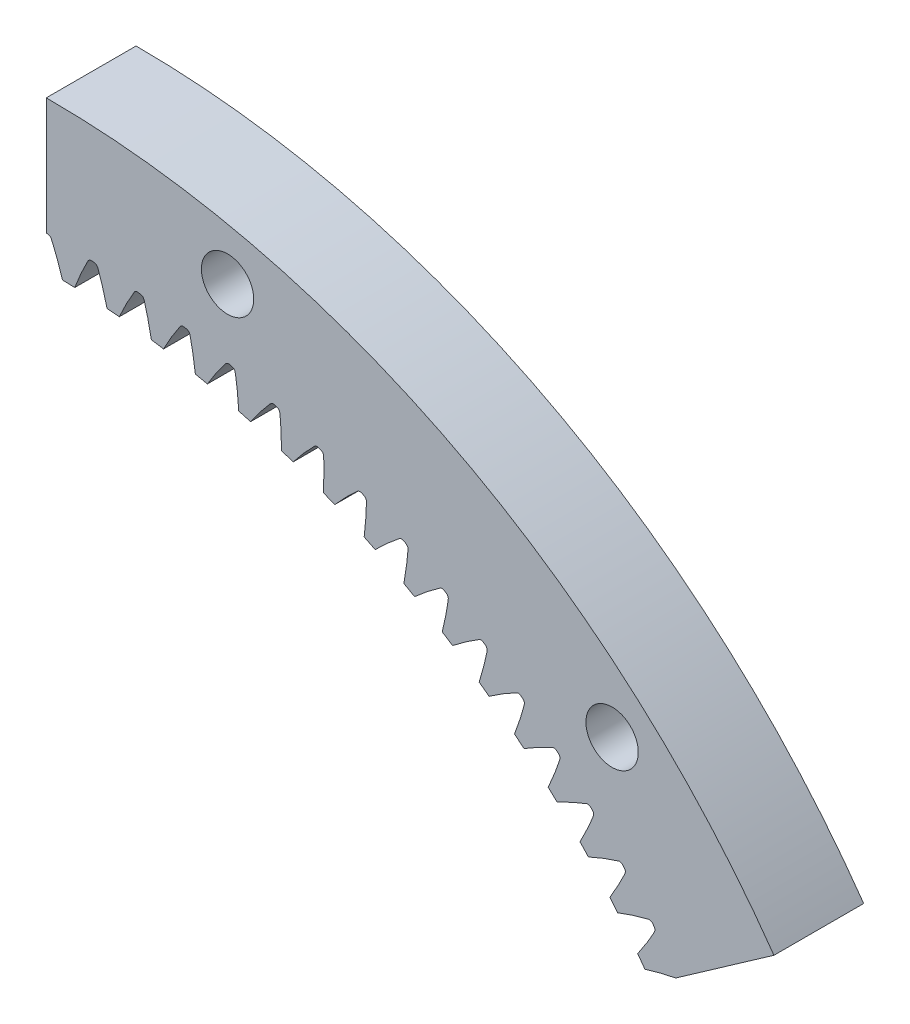
from build123d import *

# Parameters (mm, degrees)
SKETCHREVOLVESPURASSEMBLYNEW2GEAR_W       = 6
SKETCHREVOLVESPURASSEMBLYNEW2GEAR_H       = 10
TOOTHEXTRUDECUTSPURASSEMBLYNEW2GEAR_DEPTH = 4
PATTERNSPURASSEMBLYNEW2GEAR_COUNT         = 104
SKETCH_1_R                                = 1.75
CUT_EXTRUDE_1_DEPTH                       = 85.216931583


with BuildPart() as part:
    # SketchRevolveSpurAssemblyNew2Gear → SpurAssemblyNew2Gear (revolve)
    with BuildSketch(Plane(origin=(0, 0, 0), x_dir=(0, 0, -1), z_dir=(1, 0, 0))):
        with Locations((1, 54.399038462)):
            Rectangle(SKETCHREVOLVESPURASSEMBLYNEW2GEAR_W, SKETCHREVOLVESPURASSEMBLYNEW2GEAR_H)
    revolve(axis=Axis((0, 0, 0), (0, 0, -1)))

    # SketchToothSpurAssemblyNew2Gear → ToothExtrudeCutSpurAssemblyNew2Gear (cut, symmetric)
    with BuildSketch(Plane.XY):
        with BuildLine():
            ThreePointArc((49.139463497, -1.153700519), (49.153004971, 0), (49.139463497, 1.153700519))
            add(Edge.make_bspline(
                [(49.139463497, 1.153700519), (49.286109569, 1.112375592), (49.510220487, 1.045389162), (49.813750924, 0.947309864), (50.055449758, 0.865152603), (50.305972537, 0.775805702), (50.565072037, 0.678785835), (50.832899739, 0.574601978), (51.108000952, 0.459863429), (51.309373521, 0.380423551), (51.427190703, 0.322446544), (51.461136128, 0.297293766), (51.491079607, 0.26803453), (51.516447876, 0.234674807), (51.536698627, 0.198013634), (51.556477606, 0.146135037), (51.563300975, 0.091574007), (51.562323517, 0.038492677), (51.562588241, 0), (51.562323517, -0.038492677), (51.563300975, -0.091574007), (51.556477606, -0.146135037), (51.536698627, -0.198013634), (51.516447876, -0.234674807), (51.491079607, -0.26803453), (51.461136128, -0.297293766), (51.427190703, -0.322446544), (51.309373521, -0.380423551), (51.108000952, -0.459863429), (50.832899739, -0.574601978), (50.565072037, -0.678785835), (50.305972537, -0.775805702), (50.055449758, -0.865152603), (49.813750924, -0.947309864), (49.510220487, -1.045389162), (49.286109569, -1.112375592), (49.139463497, -1.153700519)],
                knots=[0, 0, 0, 0, 0.081489338, 0.125094302, 0.170606129, 0.218024819, 0.267350371, 0.318582787, 0.371722066, 0.426768208, 0.434364679, 0.441808018, 0.449251357, 0.456694696, 0.464138034, 0.471581373, 0.486277069, 0.493138537, 0.5, 0.506861463, 0.513722931, 0.528418627, 0.535861966, 0.543305304, 0.550748643, 0.558191982, 0.565635321, 0.573231792, 0.628277934, 0.681417213, 0.732649629, 0.781975181, 0.829393871, 0.874905698, 0.918510662, 1, 1, 1, 1], degree=3))
        make_face()
    toothextrudecutspurassemblynew2gear = extrude(amount=TOOTHEXTRUDECUTSPURASSEMBLYNEW2GEAR_DEPTH, both=True, mode=Mode.SUBTRACT)

    # PatternSpurAssemblyNew2Gear: ToothExtrudeCutSpurAssemblyNew2Gear ×104 about axis
    patternspurassemblynew2gear_axis = Axis((0, 0, 50), (0, 0, -1))
    for i in range(1, PATTERNSPURASSEMBLYNEW2GEAR_COUNT):
        add(toothextrudecutspurassemblynew2gear.rotate(patternspurassemblynew2gear_axis, i * 360 / PATTERNSPURASSEMBLYNEW2GEAR_COUNT), mode=Mode.SUBTRACT)

    # Эскиз1 → Вырез-Вытянуть1 (cut, through all)
    with BuildSketch(Plane.XY.offset(2)):
        with Locations((12.120618381, 54.672576399)):
            Circle(SKETCH_1_R)
        with Locations((37.833051626, 41.287530861)):
            Circle(SKETCH_1_R)
        with BuildLine():
            Line((0, 0), (0, 59.399038462))
            ThreePointArc((0, 59.399038462), (-27.427423637, -52.687590596), (48.656843785, 34.069888803))
            Line((48.656843785, 34.069888803), (0, 0))
        make_face()
    extrude(amount=-CUT_EXTRUDE_1_DEPTH, mode=Mode.SUBTRACT)


solid = part.part
